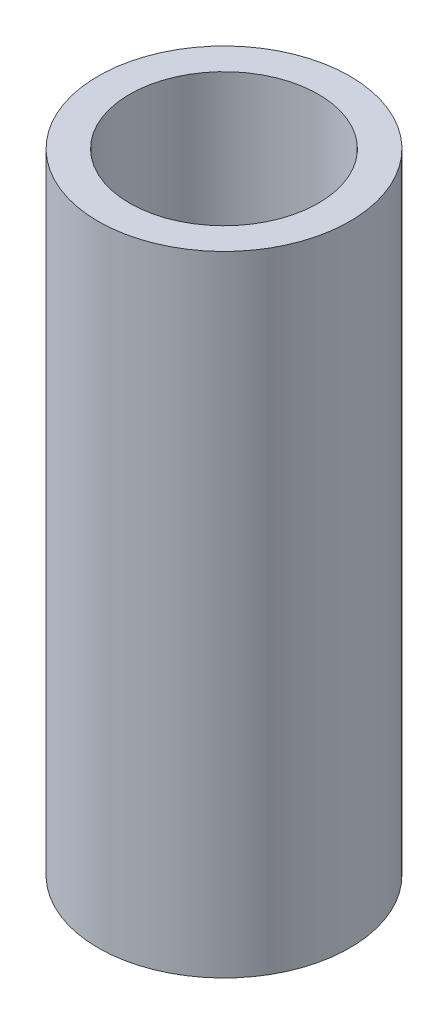
from build123d import *

# Parameters (mm, degrees)
SKETCH_1_R      = 4
SKETCH_1_R_2    = 3
EXTRUDE_1_DEPTH = 20


with BuildPart() as part:
    # Эскиз1 → Бобышка-Вытянуть1 (new body)
    with BuildSketch(Plane(origin=(0, 0, 0), x_dir=(1, 0, 0), z_dir=(0, 1, 0))):
        Circle(SKETCH_1_R)
        Circle(SKETCH_1_R_2, mode=Mode.SUBTRACT)
    extrude(amount=EXTRUDE_1_DEPTH)


solid = part.part
